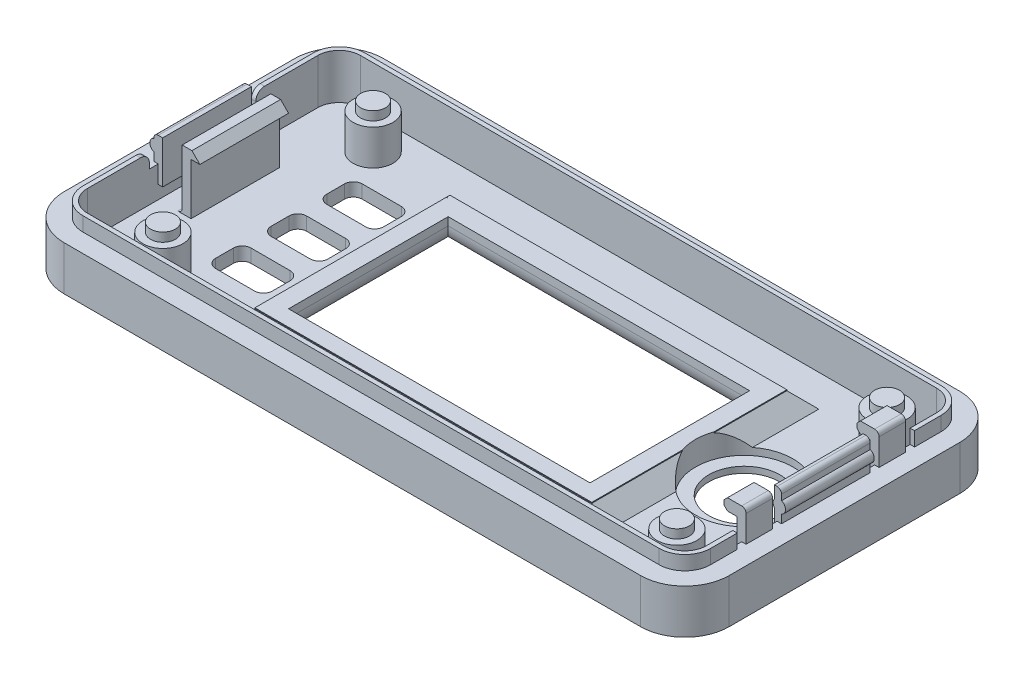
from build123d import *

# Parameters (mm, degrees)
EXTRUDE_2_DEPTH          = 5
EXTRUDE_4_DEPTH          = 1.6
SKETCH_7_W               = 0.5
SKETCH_7_H               = 10
EXTRUDE_8_DEPTH          = 2.8
SKETCH_8_R               = 0.7
EXTRUDE_9_DEPTH          = 10
FILLET_1_R               = 0.5
SKETCH_11_W              = 1
SKETCH_11_H              = 1.6
CUT_EXTRUDE_1_DEPTH      = 1.2
FILLET_2_R               = 1
SKETCH_13_W              = 0.5
SKETCH_13_H              = 10
EXTRUDE_10_DEPTH         = 2.8
CUT_EXTRUDE_START        = -3.5
CUT_EXTRUDE_2_DEPTH      = 3.5
SKETCH_13_2_W            = 0.5
SKETCH_13_2_H            = 10
EXTRUDE_11_DEPTH         = 2
EXTRUDE_12_DEPTH         = 1.6
EXTRUDE_12_DEPTH_BACK    = 2
SKETCH_5_W               = 0.3
SKETCH_5_H               = 10
SKETCH_15_R              = 2.25
EXTRUDE_13_DEPTH         = 4
SKETCH_16_R              = 1.4
EXTRUDE_14_DEPTH         = 1
SKETCH_17_W              = 0.5
SKETCH_17_H              = 1
CUT_EXTRUDE_3_DEPTH      = 1.6
SKETCH_19_W              = 0.8
SKETCH_19_H              = 10
EXTRUDE_15_DEPTH         = 1.8
SKETCH_20_R              = 0.7
EXTRUDE_16_DEPTH         = 10
FILLET_4_R               = 0.5
SKETCH_21_W              = 0.5
SKETCH_21_H              = 3
EXTRUDE_17_DEPTH         = 1.9
SKETCH_22_W              = 3
SKETCH_22_H              = 6.3
EXTRUDE_23_DEPTH         = 0.5
FILLET_12_R              = 0.5
SKETCH_29_W              = 0.5
SKETCH_29_H              = 1
CUT_EXTRUDE_5_DEPTH      = 1.6
SKETCH_30_W              = 3
SKETCH_30_H              = 1.3
EXTRUDE_26_DEPTH         = 1.5
CHAMFER_7_SIZE           = 0.4
SKETCH_24_W              = 1
SKETCH_24_H              = 10
EXTRUDE_27_DEPTH         = 6.7
FILLET_14_R              = 0.5
SKETCH_31_W              = 10
SKETCH_31_H              = 0.9
EXTRUDE_29_DEPTH         = 1
SKETCH_27_W              = 38
SKETCH_27_H              = 22
EXTRUDE_31_DEPTH         = 1.9
CHAMFER_8_SIZE           = 1.8
CUT_EXTRUDE_6_DEPTH      = 1.9
CUT_EXTRUDE_6_DEPTH_BACK = 1.5
SKETCH_26_W              = 34
SKETCH_26_H              = 18
CUT_EXTRUDE_7_DEPTH      = 1.5
SKETCH_33_R              = 5.5
CUT_EXTRUDE_8_DEPTH      = 0.8
SKETCH_34_R              = 4
CUT_EXTRUDE_9_DEPTH      = 0.8
CUT_EXTRUDE_START_2      = -0.5
CUT_EXTRUDE_11_DEPTH     = 0.5
FILLET_17_R              = 2.5
CUT_EXTRUDE_12_REACH     = 45.558
SKETCH_37_R              = 5.5
CHAMFER_9_SIZE           = 0.9


# Read off the part's stored shape, not the designer's step: 切除-拉伸11
with BuildPart() as part:
    # case 2 → 凸台-拉伸2 (new body)
    with BuildSketch(Plane(origin=(0, 0, 0), x_dir=(1, 0, 0), z_dir=(0, 1, 0))):
        with BuildLine():
            Line((-34.042196447, 18), (30.957803553, 18))
            ThreePointArc((30.957803553, 18), (34.493337459, 16.535533906), (35.957803553, 13))
            Line((35.957803553, 13), (35.957803553, -13))
            ThreePointArc((35.957803553, -13), (34.493337459, -16.535533906), (30.957803553, -18))
            Line((30.957803553, -18), (-34.042196447, -18))
            ThreePointArc((-34.042196447, -18), (-37.577730353, -16.535533906), (-39.042196447, -13))
            Line((-39.042196447, -13), (-39.042196447, 13))
            ThreePointArc((-39.042196447, 13), (-37.577730353, 16.535533906), (-34.042196447, 18))
        make_face()
    extrude(amount=EXTRUDE_2_DEPTH)

    # 草图3 → 凸台-拉伸4 (add)
    with BuildSketch(Plane(origin=(0, 5, 0), x_dir=(1, 0, 0), z_dir=(0, 1, 0))):
        with BuildLine():
            Line((-36.942196447, 13), (-36.942196447, -13))
            ThreePointArc((-36.942196447, -13), (-36.092806113, -15.050609665), (-34.042196447, -15.9))
            Line((-34.042196447, -15.9), (30.957803553, -15.9))
            ThreePointArc((30.957803553, -15.9), (33.008413218, -15.050609665), (33.857803553, -13))
            Line((33.857803553, -13), (33.857803553, 13))
            ThreePointArc((33.857803553, 13), (33.008413218, 15.050609665), (30.957803553, 15.9))
            Line((30.957803553, 15.9), (-34.042196447, 15.9))
            ThreePointArc((-34.042196447, 15.9), (-36.092806113, 15.050609665), (-36.942196447, 13))
        make_face()
        with BuildLine():
            Line((-34.042196447, -15.4), (30.957803553, -15.4))
            ThreePointArc((30.957803553, -15.4), (32.654859828, -14.697056275), (33.357803553, -13))
            Line((33.357803553, -13), (33.357803553, 13))
            ThreePointArc((33.357803553, 13), (32.654859828, 14.697056275), (30.957803553, 15.4))
            Line((30.957803553, 15.4), (-34.042196447, 15.4))
            ThreePointArc((-34.042196447, 15.4), (-35.739252722, 14.697056275), (-36.442196447, 13))
            Line((-36.442196447, 13), (-36.442196447, -13))
            ThreePointArc((-36.442196447, -13), (-35.739252722, -14.697056275), (-34.042196447, -15.4))
        make_face(mode=Mode.SUBTRACT)
    extrude(amount=EXTRUDE_4_DEPTH)

    # 草图7 → 凸台-拉伸8 (add)
    with BuildSketch(Plane(origin=(0, 5, 0), x_dir=(1, 0, 0), z_dir=(0, 1, 0))):
        with Locations((-36.692196447, 0)):
            Rectangle(SKETCH_7_W, SKETCH_7_H)
    extrude(amount=EXTRUDE_8_DEPTH)

    # 草图8 → 凸台-拉伸9 (add)
    with BuildSketch(Plane.XY.offset(5)):
        with Locations((-36.692196447, 6.6)):
            Circle(SKETCH_8_R)
    extrude(amount=-EXTRUDE_9_DEPTH)

    # 圆角1
    fillet_1_edges = [part.edges().sort_by_distance(p)[0] for p in [
        (-36.942196447, 7.8, 0),
    ]]
    fillet(fillet_1_edges, radius=FILLET_1_R - 0.0001)  # a hair under: the kernel refuses the full size

    # 草图11 → 切除-拉伸1 (cut)
    with BuildSketch(Plane.ZY.offset(36.942196447)):
        with Locations((5.5, 5.8)):
            Rectangle(SKETCH_11_W, SKETCH_11_H)
        with Locations((-5.5, 5.8)):
            Rectangle(SKETCH_11_W, SKETCH_11_H)
    extrude(amount=-CUT_EXTRUDE_1_DEPTH, mode=Mode.SUBTRACT)

    # 圆角2
    fillet_2_edges = [part.edges().sort_by_distance(p)[0] for p in [
        (-36.692196447, 6.6, 6),
        (-36.692196447, 6.6, -6),
    ]]
    fillet(fillet_2_edges, radius=FILLET_2_R)

    # 草图13 → 凸台-拉伸10 (add)
    with BuildSketch(Plane(origin=(0, 5, 0), x_dir=(1, 0, 0), z_dir=(0, 1, 0))):
        with Locations((-36.192196447, 0)):
            Rectangle(SKETCH_13_W, SKETCH_13_H)
    extrude(amount=EXTRUDE_10_DEPTH)

    # 草图14 → 切除-拉伸2 (cut)
    with BuildSketch(Plane(origin=(0, 5, 0), x_dir=(1, 0, 0), z_dir=(0, 1, 0)).offset(CUT_EXTRUDE_START)):
        with BuildLine():
            Line((-34.042196447, -15.4), (30.957803553, -15.4))
            ThreePointArc((30.957803553, -15.4), (32.654859828, -14.697056275), (33.357803553, -13))
            Line((33.357803553, -13), (33.357803553, 13))
            ThreePointArc((33.357803553, 13), (32.654859828, 14.697056275), (30.957803553, 15.4))
            Line((30.957803553, 15.4), (-34.042196447, 15.4))
            ThreePointArc((-34.042196447, 15.4), (-35.739252722, 14.697056275), (-36.442196447, 13))
            Line((-36.442196447, 13), (-36.442196447, -13))
            ThreePointArc((-36.442196447, -13), (-35.739252722, -14.697056275), (-34.042196447, -15.4))
        make_face()
    extrude(amount=CUT_EXTRUDE_2_DEPTH, mode=Mode.SUBTRACT)

    # 草图13<2> → 凸台-拉伸11 (add)
    with BuildSketch(Plane(origin=(0, 5, 0), x_dir=(1, 0, 0), z_dir=(0, 1, 0))):
        with Locations((-36.192196447, 0)):
            Rectangle(SKETCH_13_2_W, SKETCH_13_2_H)
    extrude(amount=-EXTRUDE_11_DEPTH)

    # 草图5 → 凸台-拉伸12 (add, two sides: drawn at the far end of the back side and taken through both)
    with BuildSketch(Plane(origin=(0, 5, 0), x_dir=(1, 0, 0), z_dir=(0, 1, 0)).offset(-EXTRUDE_12_DEPTH_BACK)):
        with Locations((33.207803553, 0)):
            Rectangle(SKETCH_5_W, SKETCH_5_H)
    extrude(amount=EXTRUDE_12_DEPTH + EXTRUDE_12_DEPTH_BACK)

    # 草图15 → 凸台-拉伸13 (add)
    with BuildSketch(Plane(origin=(0, 1.5, 0), x_dir=(1, 0, 0), z_dir=(0, 1, 0))):
        with Locations(Location((28.957803553, -11.9, 0), (0, 0, 270))):
            Circle(SKETCH_15_R)
        with Locations(Location((-29.012994719, -11.9, 0), (0, 0, 270))):
            Circle(SKETCH_15_R)
        with Locations(Location((28.957803553, 11.8, 0), (0, 0, 270))):
            Circle(SKETCH_15_R)
        with Locations(Location((-29.012994719, 11.8, 0), (0, 0, 270))):
            Circle(SKETCH_15_R)
    extrude(amount=EXTRUDE_13_DEPTH)

    # 草图16 → 凸台-拉伸14 (add)
    with BuildSketch(Plane(origin=(0, 5.5, 0), x_dir=(1, 0, 0), z_dir=(0, 1, 0))):
        with Locations(Location((28.957803553, -11.9, 0), (0, 0, 270))):
            Circle(SKETCH_16_R)
        with Locations(Location((28.957803553, 11.8, 0), (0, 0, 270))):
            Circle(SKETCH_16_R)
        with Locations(Location((-29.012994719, -11.9, 0), (0, 0, 270))):
            Circle(SKETCH_16_R)
        with Locations(Location((-29.012994719, 11.8, 0), (0, 0, 270))):
            Circle(SKETCH_16_R)
    extrude(amount=EXTRUDE_14_DEPTH)

    # 草图17 → 切除-拉伸3 (cut)
    with BuildSketch(Plane(origin=(0, 6.6, 0), x_dir=(1, 0, 0), z_dir=(0, 1, 0))):
        with Locations((33.607803553, -5.5)):
            Rectangle(SKETCH_17_W, SKETCH_17_H)
        with Locations((33.607803553, 5.5)):
            Rectangle(SKETCH_17_W, SKETCH_17_H)
    extrude(amount=-CUT_EXTRUDE_3_DEPTH, mode=Mode.SUBTRACT)

    # 草图19 → 凸台-拉伸15 (add)
    with BuildSketch(Plane(origin=(0, 6.6, 0), x_dir=(1, 0, 0), z_dir=(0, 1, 0))):
        with Locations((33.457803553, 0)):
            Rectangle(SKETCH_19_W, SKETCH_19_H)
    extrude(amount=EXTRUDE_15_DEPTH)

    # 草图20 → 凸台-拉伸16 (add)
    with BuildSketch(Plane(origin=(0, 0, -5), x_dir=(-1, 0, 0), z_dir=(0, 0, -1))):
        with Locations((-33.607803553, 6.6)):
            Circle(SKETCH_20_R)
    extrude(amount=-EXTRUDE_16_DEPTH)

    # 圆角4
    fillet_4_edges = [part.edges().sort_by_distance(p)[0] for p in [
        (33.857803553, 8.4, 0),
    ]]
    fillet(fillet_4_edges, radius=FILLET_4_R)

    # 草图21 → 凸台-拉伸17 (add)
    with BuildSketch(Plane(origin=(0, 6.6, 0), x_dir=(1, 0, 0), z_dir=(0, 1, 0))):
        with Locations((33.607803553, -7.5)):
            Rectangle(SKETCH_21_W, SKETCH_21_H)
        with Locations((33.607803553, 7.5)):
            Rectangle(SKETCH_21_W, SKETCH_21_H)
    extrude(amount=EXTRUDE_17_DEPTH)

    # 草图22 → 凸台-拉伸23 (add)
    with BuildSketch(Plane.ZY.offset(-33.357803553)):
        with Locations((-7.5, 5.35)):
            Rectangle(SKETCH_22_W, SKETCH_22_H)
        with Locations((7.5, 5.35)):
            Rectangle(SKETCH_22_W, SKETCH_22_H)
    extrude(amount=EXTRUDE_23_DEPTH)

    # 圆角12
    fillet_12_edges = [part.edges().sort_by_distance(p)[0] for p in [
        (33.857803553, 8.5, 7.5),
        (33.857803553, 8.5, -7.5),
    ]]
    fillet(fillet_12_edges, radius=FILLET_12_R)

    # 草图29 → 切除-拉伸5 (cut)
    with BuildSketch(Plane(origin=(0, 6.6, 0), x_dir=(1, 0, 0), z_dir=(0, 1, 0))):
        with Locations((33.607803553, -9.5)):
            Rectangle(SKETCH_29_W, SKETCH_29_H)
        with Locations((33.607803553, 9.5)):
            Rectangle(SKETCH_29_W, SKETCH_29_H)
    extrude(amount=-CUT_EXTRUDE_5_DEPTH, mode=Mode.SUBTRACT)

    # 草图30 → 凸台-拉伸26 (add)
    with BuildSketch(Plane.ZY.offset(-32.857803553)):
        with Locations((7.5, 7.85)):
            Rectangle(SKETCH_30_W, SKETCH_30_H)
        with Locations((-7.5, 7.85)):
            Rectangle(SKETCH_30_W, SKETCH_30_H)
    extrude(amount=EXTRUDE_26_DEPTH)

    # 倒角7
    chamfer_7_edges = [part.edges().sort_by_distance(p)[0] for p in [
        (31.357803553, 7.2, 7.5),
        (31.357803553, 8.5, 7.5),
        (31.357803553, 7.2, -7.5),
        (31.357803553, 8.5, -7.5),
    ]]
    chamfer(chamfer_7_edges, length=CHAMFER_7_SIZE)

    # 草图24 → 凸台-拉伸27 (add)
    with BuildSketch(Plane(origin=(0, 1.5, 0), x_dir=(1, 0, 0), z_dir=(0, 1, 0))):
        with Locations((-33.242196447, 0)):
            Rectangle(SKETCH_24_W, SKETCH_24_H)
    extrude(amount=EXTRUDE_27_DEPTH)

    # 圆角14
    fillet_14_edges = [part.edges().sort_by_distance(p)[0] for p in [
        (-33.742196447, 1.5, 0),
    ]]
    fillet(fillet_14_edges, radius=FILLET_14_R)

    # 草图31 → 凸台-拉伸29 (add)
    with BuildSketch(Plane(origin=(-32.742196447, 0, 0), x_dir=(0, 0, -1), z_dir=(1, 0, 0))):
        with Locations((0, 7.75)):
            Rectangle(SKETCH_31_W, SKETCH_31_H)
    extrude(amount=EXTRUDE_29_DEPTH)

    # 草图27 → 凸台-拉伸31 (add)
    with BuildSketch(Plane(origin=(0, 1.5, 0), x_dir=(1, 0, 0), z_dir=(0, 1, 0))):
        with Locations((0.457803553, -1)):
            Rectangle(SKETCH_27_W, SKETCH_27_H)
    extrude(amount=EXTRUDE_31_DEPTH)

    # 倒角8
    chamfer_8_edges = [part.edges().sort_by_distance(p)[0] for p in [
        (19.457803553, 1.5, 1),
        (0.457803553, 1.5, -10),
        (-18.542196447, 1.5, 1),
        (0.457803553, 1.5, 12),
    ]]
    chamfer(chamfer_8_edges, length=CHAMFER_8_SIZE)

    # 草图26 → 切除-拉伸6 (cut, two sides: drawn at the far end of the back side and taken through both)
    with BuildSketch(Plane(origin=(0, 1.5, 0), x_dir=(1, 0, 0), z_dir=(0, 1, 0)).offset(-CUT_EXTRUDE_6_DEPTH_BACK)):
        with Locations((0.457803553, -1.2)):
            Rectangle(SKETCH_26_W, SKETCH_26_H)
    extrude(amount=CUT_EXTRUDE_6_DEPTH + CUT_EXTRUDE_6_DEPTH_BACK, mode=Mode.SUBTRACT)

    # 草图32 → 切除-拉伸7 (cut)
    with BuildSketch(Plane.XZ):
        with BuildLine():
            Line((-26.492196447, 8.48), (-22.092196447, 8.48))
            ThreePointArc((-22.092196447, 8.48), (-21.385089666, 8.187106781), (-21.092196447, 7.48))
            Line((-21.092196447, 7.48), (-21.092196447, 5.48))
            ThreePointArc((-21.092196447, 5.48), (-21.385089666, 4.772893219), (-22.092196447, 4.48))
            Line((-22.092196447, 4.48), (-26.492196447, 4.48))
            ThreePointArc((-26.492196447, 4.48), (-27.199303228, 4.772893219), (-27.492196447, 5.48))
            Line((-27.492196447, 5.48), (-27.492196447, 7.48))
            ThreePointArc((-27.492196447, 7.48), (-27.199303228, 8.187106781), (-26.492196447, 8.48))
        make_face()
        with BuildLine():
            Line((-26.492196447, 2.21), (-22.092196447, 2.21))
            ThreePointArc((-22.092196447, 2.21), (-21.385089666, 1.917106781), (-21.092196447, 1.21))
            Line((-21.092196447, 1.21), (-21.092196447, -0.79))
            ThreePointArc((-21.092196447, -0.79), (-21.385089666, -1.497106781), (-22.092196447, -1.79))
            Line((-22.092196447, -1.79), (-26.492196447, -1.79))
            ThreePointArc((-26.492196447, -1.79), (-27.199303228, -1.497106781), (-27.492196447, -0.79))
            Line((-27.492196447, -0.79), (-27.492196447, 1.21))
            ThreePointArc((-27.492196447, 1.21), (-27.199303228, 1.917106781), (-26.492196447, 2.21))
        make_face()
        with BuildLine():
            Line((-26.492196447, -4.06), (-22.092196447, -4.06))
            ThreePointArc((-22.092196447, -4.06), (-21.385089666, -4.352893219), (-21.092196447, -5.06))
            Line((-21.092196447, -5.06), (-21.092196447, -7.06))
            ThreePointArc((-21.092196447, -7.06), (-21.385089666, -7.767106781), (-22.092196447, -8.06))
            Line((-22.092196447, -8.06), (-26.492196447, -8.06))
            ThreePointArc((-26.492196447, -8.06), (-27.199303228, -7.767106781), (-27.492196447, -7.06))
            Line((-27.492196447, -7.06), (-27.492196447, -5.06))
            ThreePointArc((-27.492196447, -5.06), (-27.199303228, -4.352893219), (-26.492196447, -4.06))
        make_face()
    extrude(amount=-CUT_EXTRUDE_7_DEPTH, mode=Mode.SUBTRACT)

    # 草图33 → 切除-拉伸8 (cut)
    with BuildSketch(Plane(origin=(0, 1.5, 0), x_dir=(1, 0, 0), z_dir=(0, 1, 0))):
        with Locations(Location((24.657803553, 0, 0), (0, 0, 270))):
            Circle(SKETCH_33_R)
    extrude(amount=-CUT_EXTRUDE_8_DEPTH, mode=Mode.SUBTRACT)

    # 草图34 → 切除-拉伸9 (cut)
    with BuildSketch(Plane(origin=(0, 0.7, 0), x_dir=(1, 0, 0), z_dir=(0, 1, 0))):
        with Locations(Location((24.657803553, 0, 0), (0, 0, 270))):
            Circle(SKETCH_34_R)
    extrude(amount=-CUT_EXTRUDE_9_DEPTH, mode=Mode.SUBTRACT)

    # 切除-拉伸11 outline → 切除-拉伸11 (cut)
    with BuildSketch(Plane.XZ.offset(CUT_EXTRUDE_START_2)):
        with BuildLine():
            Line((-33.234161348, -14.51479109), (-32.946609498, -14.682541858))
            add(Edge.make_bspline(
                [(-32.946609498, -14.682541858), (-32.852733423, -14.734452816), (-32.748911507, -14.762413309), (-32.541218919, -14.762413309), (-32.437372625, -14.734452816), (-32.343520928, -14.682541858)],
                knots=[3, 3, 3, 3, 4, 4, 5, 5, 5, 5], degree=3))
            Line((-32.343520928, -14.682541858), (-32.055944701, -14.51479109))
            Line((-32.055944701, -14.51479109), (-30.564214631, -13.654097894))
            Line((-30.564214631, -13.654097894), (-30.276638404, -13.488346046))
            add(Edge.make_bspline(
                [(-30.276638404, -13.488346046), (-30.090933928, -13.380514102), (-29.975094119, -13.180817192), (-29.975094119, -12.967140035)],
                knots=[8, 8, 8, 8, 9, 9, 9, 9], degree=3))
            Line((-29.975094119, -12.967140035), (-29.975094119, -10.578760599))
            add(Edge.make_bspline(
                [(-29.975094119, -10.578760599), (-29.975094119, -10.363096712), (-30.090933928, -10.165386532), (-30.276638404, -10.057554588)],
                knots=[10, 10, 10, 10, 11, 11, 11, 11], degree=3))
            Line((-30.276638404, -10.057554588), (-30.564214631, -9.89180274))
            Line((-30.564214631, -9.89180274), (-32.055944701, -9.031109544))
            Line((-32.055944701, -9.031109544), (-32.343520928, -8.863370964))
            add(Edge.make_bspline(
                [(-32.343520928, -8.863370964), (-32.437372625, -8.809448898), (-32.541218919, -8.783487325), (-32.748911507, -8.783487325), (-32.852733423, -8.809448898), (-32.946609498, -8.863370964)],
                knots=[14, 14, 14, 14, 15, 15, 16, 16, 16, 16], degree=3))
            Line((-32.946609498, -8.863370964), (-33.234161348, -9.031109544))
            Line((-33.234161348, -9.031109544), (-34.725891418, -9.89180274))
            Line((-34.725891418, -9.89180274), (-35.013443268, -10.057554588))
            add(Edge.make_bspline(
                [(-35.013443268, -10.057554588), (-35.201171039, -10.165386532), (-35.314987552, -10.363096712), (-35.314987552, -10.578760599)],
                knots=[19, 19, 19, 19, 20, 20, 20, 20], degree=3))
            Line((-35.314987552, -10.578760599), (-35.314987552, -12.967140035))
            add(Edge.make_bspline(
                [(-35.314987552, -12.967140035), (-35.314987552, -13.180817192), (-35.201171039, -13.380514102), (-35.013443268, -13.488346046)],
                knots=[21, 21, 21, 21, 22, 22, 22, 22], degree=3))
            Line((-35.013443268, -13.488346046), (-34.725891418, -13.654097894))
            Line((-34.725891418, -13.654097894), (-33.234161348, -14.51479109))
        make_face()
        with BuildLine():
            add(Edge.make_bspline(
                [(-32.451340683, -11.93670934), (-32.571153954, -11.866808109), (-32.720926637, -11.866808109), (-32.840764285, -11.93670934)],
                knots=[7, 7, 7, 7, 8, 8, 8, 8], degree=3))
            add(Edge.make_bspline(
                [(-30.642099351, -12.981120281), (-30.64609719, -12.979121362), (-32.451340683, -11.93670934)],
                knots=[0, 0, 0, 1, 1, 1], degree=2))
            add(Edge.make_bspline(
                [(-30.660065248, -13.250706235), (-30.558217873, -13.192798519), (-30.548247654, -13.049010405), (-30.642099351, -12.981120281)],
                knots=[1, 1, 1, 1, 2, 2, 2, 2], degree=3))
            Line((-30.660065248, -13.250706235), (-32.505262749, -14.317093099))
            add(Edge.make_bspline(
                [(-32.786842219, -14.317093099), (-32.698987279, -14.367017327), (-32.591143147, -14.367017327), (-32.505262749, -14.317093099)],
                knots=[3, 3, 3, 3, 4, 4, 4, 4], degree=3))
            Line((-32.786842219, -14.317093099), (-34.622045124, -13.248707316))
            add(Edge.make_bspline(
                [(-34.624044043, -13.003084016), (-34.717895741, -13.059005002), (-34.715896821, -13.194797438), (-34.622045124, -13.248707316)],
                knots=[5, 5, 5, 5, 6, 6, 6, 6], degree=3))
            Line((-34.624044043, -13.003084016), (-32.840764285, -11.93670934))
        make_face(mode=Mode.SUBTRACT)
        with BuildLine():
            add(Edge.make_bspline(
                [(-34.552156081, -11.784937738), (-34.396411017, -11.69707061), (-34.286567966, -11.53731552), (-34.286567966, -11.395526325), (-34.286567966, -11.25773497), (-34.396411017, -11.219792069), (-34.552156081, -11.309658117)],
                knots=[0, 0, 0, 0, 1, 1, 1, 2, 2, 2, 2], degree=3))
            add(Edge.make_bspline(
                [(-34.552156081, -11.309658117), (-34.705926602, -11.395526325), (-34.815745276, -11.557280335), (-34.815745276, -11.695071691), (-34.815745276, -11.834861966), (-34.705926602, -11.872804867), (-34.552156081, -11.784937738)],
                knots=[2, 2, 2, 2, 3, 3, 3, 4, 4, 4, 4], degree=3))
        make_face(mode=Mode.SUBTRACT)
        with BuildLine():
            add(Edge.make_bspline(
                [(-34.76182321, -10.25325366), (-34.773816726, -10.259250418), (-34.781812403, -10.273230664), (-34.781812403, -10.287210911)],
                knots=[0, 0, 0, 0, 1, 1, 1, 1], degree=3))
            Line((-34.76182321, -10.25325366), (-34.378420744, -10.035590853))
            add(Edge.make_bspline(
                [(-34.320500839, -10.069535915), (-34.320500839, -10.039588692), (-34.35245917, -10.021610607), (-34.378420744, -10.035590853)],
                knots=[2, 2, 2, 2, 3, 3, 3, 3], degree=3))
            Line((-34.320500839, -10.069535915), (-34.320500839, -10.950206116))
            add(Edge.make_bspline(
                [(-34.340490032, -10.984151178), (-34.328496516, -10.976167689), (-34.320500839, -10.964174173), (-34.320500839, -10.950206116)],
                knots=[4, 4, 4, 4, 5, 5, 5, 5], degree=3))
            Line((-34.340490032, -10.984151178), (-34.723892498, -11.199827254))
            add(Edge.make_bspline(
                [(-34.781812403, -11.165870003), (-34.781812403, -11.195829415), (-34.749854072, -11.213795311), (-34.723892498, -11.199827254)],
                knots=[6, 6, 6, 6, 7, 7, 7, 7], degree=3))
            Line((-34.781812403, -11.165870003), (-34.781812403, -10.287210911))
        make_face(mode=Mode.SUBTRACT)
        with BuildLine():
            add(Edge.make_bspline(
                [(-33.369941596, -10.484908902), (-33.597623376, -10.61271785), (-33.705443131, -10.780456429), (-33.705443131, -11.165870003), (-33.581632022, -11.163871084), (-33.357972457, -11.036074324)],
                knots=[0, 0, 0, 0, 1, 1, 2.031545133, 2.031545133, 2.031545133, 2.031545133], degree=3))
            Line((-33.357972457, -11.036074324), (-33.186236039, -10.940211519))
            add(Edge.make_bspline(
                [(-33.166246847, -10.906266457), (-33.166246847, -10.920246704), (-33.174242524, -10.93422695), (-33.186236039, -10.940211519)],
                knots=[4, 4, 4, 4, 5, 5, 5, 5], degree=3))
            Line((-33.166246847, -10.906266457), (-33.166246847, -9.380579137))
            add(Edge.make_bspline(
                [(-33.146306408, -9.346634075), (-33.160274466, -9.354617563), (-33.166246847, -9.36659889), (-33.166246847, -9.380579137)],
                knots=[3, 3, 3, 3, 4, 4, 4, 4], degree=3))
            Line((-33.146306408, -9.346634075), (-32.758881726, -9.126972349))
            add(Edge.make_bspline(
                [(-32.700961821, -9.160917411), (-32.700961821, -9.130957999), (-32.732920152, -9.112992102), (-32.758881726, -9.126972349)],
                knots=[5, 5, 5, 5, 6, 6, 6, 6], degree=3))
            Line((-32.700961821, -9.160917411), (-32.700961821, -11.010112751))
            add(Edge.make_bspline(
                [(-32.720926637, -11.044057813), (-32.706958579, -11.038073244), (-32.700961821, -11.024092997), (-32.700961821, -11.010112751)],
                knots=[7, 7, 7, 7, 8, 8, 8, 8], degree=3))
            Line((-32.720926637, -11.044057813), (-33.379936192, -11.41749006))
            add(Edge.make_bspline(
                [(-33.379936192, -11.41749006), (-33.807290505, -11.65912771), (-34.16073356, -11.707053018), (-34.16073356, -10.766476182), (-33.803292667, -10.361097792), (-33.393928627, -10.129442551)],
                knots=[9, 9, 9, 9, 10, 10, 10.962489192, 10.962489192, 10.962489192, 10.962489192], degree=3))
            Line((-33.393928627, -10.129442551), (-33.186236039, -10.013627118))
            Line((-33.186236039, -10.013627118), (-33.186236039, -10.393043935))
            Line((-33.186236039, -10.393043935), (-33.369941596, -10.484908902))
        make_face(mode=Mode.SUBTRACT)
    extrude(amount=CUT_EXTRUDE_11_DEPTH, mode=Mode.SUBTRACT)

    # 圆角17
    fillet_17_edges = [part.edges().sort_by_distance(p)[0] for p in [
        (-16.542196447, 0, 1.2),
        (0.457803553, 0, 10.2),
        (17.457803553, 0, 1.2),
        (0.457803553, 0, -7.8),
    ]]
    fillet(fillet_17_edges, radius=FILLET_17_R)

    # 草图37 → 切除-拉伸12 (cut, up to next)
    with BuildSketch(Plane(origin=(0, 1.5, 0), x_dir=(1, 0, 0), z_dir=(0, 1, 0)), mode=Mode.PRIVATE) as cut_extrude_12_sk1:
        with Locations(Location((24.657803553, 0, 0), (0, 0, 270))):
            Circle(SKETCH_37_R)
    cut_extrude_12_tool1 = extrude(cut_extrude_12_sk1.sketch, amount=CUT_EXTRUDE_12_REACH, mode=Mode.PRIVATE) & part.part
    add(cut_extrude_12_tool1.solids().sort_by_distance((24.657804, 1.5, 0))[0], mode=Mode.SUBTRACT)

    # 倒角9
    chamfer_9_edges = [part.edges().sort_by_distance(p)[0] for p in [
        (-31.742196447, 8.2, 0),
    ]]
    chamfer(chamfer_9_edges, length=CHAMFER_9_SIZE - 0.0001)  # a hair under: the kernel refuses the full size


solid = part.part
